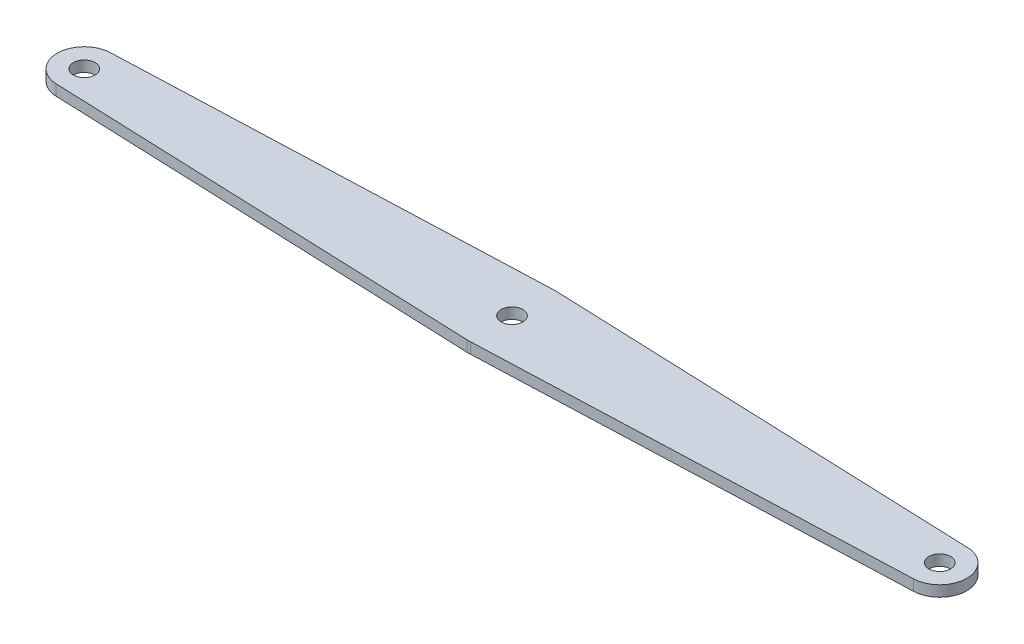
from build123d import *

# Parameters (mm, degrees)
EXTRUDE_446_DEPTH     = 2
SKETCH_2_R            = 2
CUT_EXTRUDE_657_DEPTH = 85.403244648
SKETCH_3_R            = 2
CUT_EXTRUDE_883_DEPTH = 85.403244648


with BuildPart() as part:
    # Эскиз1 → Extrude 446 (new body)
    with BuildSketch(Plane(origin=(0, 0, 0), x_dir=(1, 0, 0), z_dir=(0, 1, 0))):
        with BuildLine():
            Line((-79.189873418, 4.996393508), (-0.303797468, 7.994229613))
            Line((-0.303797468, 7.994229613), (0.303797468, 7.994229613))
            Line((0.303797468, 7.994229613), (79.189873418, 4.996393508))
            ThreePointArc((79.189873418, 4.996393508), (84, 0), (79.189873418, -4.996393508))
            Line((79.189873418, -4.996393508), (0.303797468, -7.994229613))
            Line((0.303797468, -7.994229613), (-0.303797468, -7.994229613))
            Line((-0.303797468, -7.994229613), (-79.189873418, -4.996393508))
            ThreePointArc((-79.189873418, -4.996393508), (-84, 0), (-79.189873418, 4.996393508))
        make_face()
    extrude(amount=EXTRUDE_446_DEPTH)

    # Эскиз2 → Cut-Extrude 657 (cut, through all)
    with BuildSketch(Plane(origin=(0, 2, 0), x_dir=(1, 0, 0), z_dir=(0, 1, 0))):
        Circle(SKETCH_2_R)
    extrude(amount=-CUT_EXTRUDE_657_DEPTH, mode=Mode.SUBTRACT)

    # Эскиз3 → Cut-Extrude 883 (cut, through all)
    with BuildSketch(Plane(origin=(0, 2, 0), x_dir=(1, 0, 0), z_dir=(0, 1, 0))):
        with Locations((-79, 0)):
            Circle(SKETCH_3_R)
        with Locations((79, 0)):
            Circle(SKETCH_3_R)
    extrude(amount=-CUT_EXTRUDE_883_DEPTH, mode=Mode.SUBTRACT)


solid = part.part
